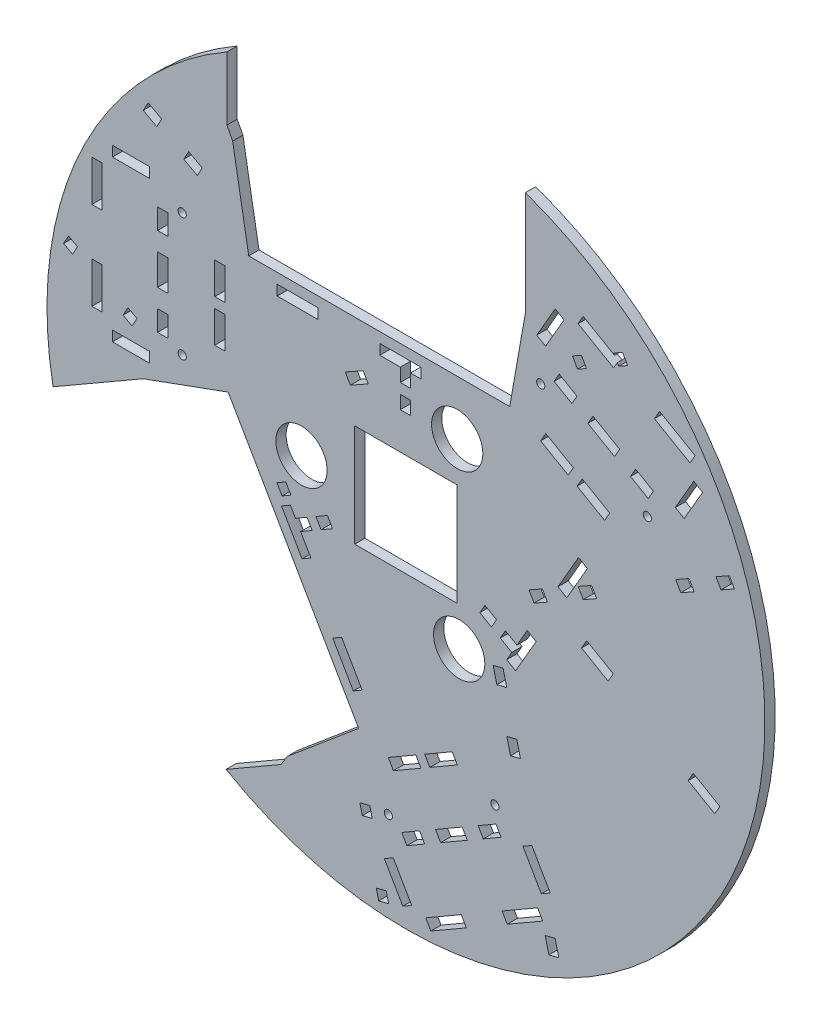
from build123d import *

# Parameters (mm, degrees)
ESQUISSE1_R                   = 175
BOSS_EXTRU_1_DEPTH            = 5
ESQUISSE2_W                   = 18
ESQUISSE2_H                   = 5
ESQUISSE2_W_2                 = 5
ESQUISSE2_H_2                 = 20
ESQUISSE2_H_3                 = 10
ESQUISSE2_H_4                 = 15
ESQUISSE2_H_5                 = 15.5
ESQUISSE2_W_3                 = 20
ESQUISSE2_H_6                 = 6.5
ENL_V_MAT_EXTRU_1_DEPTH       = 5
ESQUISSE6_R                   = 12.5
ESQUISSE6_W                   = 50
ESQUISSE6_H                   = 50
ENL_V_MAT_EXTRU_6_DEPTH       = 5
TROUS_DE_CENTRAGE_4_0MM1_D    = 4
HOLES_CATCHERS_OF_GLASS_DEPTH = 10
HOLES_BOARDS_SERVO_DEPTH      = 10


with BuildPart() as part:
    # Esquisse1 → Boss.-Extru.1 (new body)
    with BuildSketch(Plane.XY):
        with Locations((148.080426897, -12.110171348)):
            Circle(ESQUISSE1_R)
    extrude(amount=BOSS_EXTRU_1_DEPTH)

    # Esquisse2 → Enlèv. mat.-Extru.1 (cut)
    with BuildSketch(Plane.XY.offset(5)):
        Polygon((135.311788567, 53.777441362), (135.311788567, 48.777441362), (145.311788567, 48.777441362), (145.311788567, 42.277441362), (150.311788567, 42.277441362), (150.311788567, 48.777441362), (155.311788567, 48.777441362), (155.311788567, 53.777441362), align=None)
        with Locations((14, 69.777441362)):
            Rectangle(ESQUISSE2_W, ESQUISSE2_H)
        with Locations((-2.5, 52.277441362)):
            Rectangle(ESQUISSE2_W_2, ESQUISSE2_H_2)
        with Locations((-2.5, 9.277441362)):
            Rectangle(ESQUISSE2_W_2, ESQUISSE2_H_2)
        with Locations((14, -8.222558638)):
            Rectangle(ESQUISSE2_W, ESQUISSE2_H)
        with Locations((29.5, 9.277441362)):
            Rectangle(ESQUISSE2_W_2, ESQUISSE2_H_3)
        with Locations((29.5, 30.777441362)):
            Rectangle(ESQUISSE2_W_2, ESQUISSE2_H_4)
        with Locations((29.5, 52.277441362)):
            Rectangle(ESQUISSE2_W_2, ESQUISSE2_H_3)
        with Locations((57.36, 41.027441362)):
            Rectangle(ESQUISSE2_W_2, ESQUISSE2_H_5)
        with Locations((57.36, 20.527441362)):
            Rectangle(ESQUISSE2_W_2, ESQUISSE2_H_5)
        with Locations((95.311788567, 51.277441362)):
            Rectangle(ESQUISSE2_W_3, ESQUISSE2_H)
        with Locations((147.811788567, 34.027441362)):
            Rectangle(ESQUISSE2_W_2, ESQUISSE2_H_6)
        Polygon((292.702456717, 69.607306773), (283.702456717, 54.018849505), (279.372329698, 56.518849505), (288.372329698, 72.107306773), align=None)
        Polygon((289.042202679, 83.267560811), (286.542202679, 78.937433792), (269.221694603, 88.937433792), (271.721694603, 93.267560811), align=None)
        Polygon((251.803110316, 104.767560811), (249.303110316, 100.437433792), (231.982602241, 110.437433792), (234.482602241, 114.767560811), align=None)
        Polygon((225.152475222, 108.607306773), (216.152475222, 93.018849505), (211.822348203, 95.518849505), (220.822348203, 111.107306773), align=None)
        Polygon((231.472983297, 79.55474789), (228.972983297, 75.224620871), (220.31272926, 80.224620871), (222.81272926, 84.55474789), align=None)
        Polygon((252.257592988, 67.55474789), (249.757592988, 63.224620871), (236.767211932, 70.724620871), (239.267211932, 75.05474789), align=None)
        Polygon((268.71207566, 58.05474789), (266.21207566, 53.724620871), (257.551821622, 58.724620871), (260.051821622, 63.05474789), align=None)
        Polygon((247.420859728, 38.17728014), (244.920859728, 33.847153121), (231.497465969, 41.597153121), (233.997465969, 45.92728014), align=None)
        Polygon((229.66733895, 48.42728014), (227.16733895, 44.097153121), (213.743945192, 51.847153121), (216.243945192, 56.17728014), align=None)
        Polygon((211.525092463, -33.996012539), (207.194965444, -31.496012539), (202.194965444, -40.156266577), (196.56580032, -36.906266577), (194.06580032, -41.236393596), (199.694965444, -44.486393596), (197.194965444, -48.816520615), (201.525092463, -51.316520615), align=None)
        Polygon((236.525092463, 9.30525765), (226.525092463, -8.015250425), (222.194965444, -5.515250425), (232.194965444, 11.80525765), align=None)
        Polygon((192.235673301, -34.406266577), (189.735673301, -38.736393596), (184.106508176, -35.486393596), (186.606508176, -31.156266577), align=None)
        Polygon((146.538823973, -178.215262181), (137.538823973, -162.626804912), (141.868950992, -160.126804912), (150.868950992, -175.715262181), align=None)
        Polygon((160.199078011, -181.875516218), (157.699078011, -177.545389199), (175.019586086, -167.545389199), (177.519586086, -171.875516218), align=None)
        Polygon((197.438170373, -160.375516218), (194.938170373, -156.045389199), (212.258678449, -146.045389199), (214.758678449, -150.375516218), align=None)
        Polygon((214.088805468, -139.215262181), (205.088805468, -123.626804912), (209.418932487, -121.126804912), (218.418932487, -136.715262181), align=None)
        Polygon((185.768297392, -130.162703297), (183.268297392, -125.832576278), (191.92855143, -120.832576278), (194.42855143, -125.162703297), align=None)
        Polygon((164.983687701, -142.162703297), (162.483687701, -137.832576278), (175.474068758, -130.332576278), (177.974068758, -134.662703297), align=None)
        Polygon((148.52920503, -151.662703297), (146.02920503, -147.332576278), (154.689459067, -142.332576278), (157.189459067, -146.662703297), align=None)
        Polygon((141.960420962, -123.285235548), (139.460420962, -118.955108529), (152.88381472, -111.205108529), (155.38381472, -115.535235548), align=None)
        Polygon((159.713941739, -113.035235548), (157.213941739, -108.705108529), (170.637335498, -100.955108529), (173.137335498, -105.285235548), align=None)
        Polygon((97.404399659, -56.111942869), (101.734526678, -53.611942869), (96.734526678, -44.951688831), (102.363691803, -41.701688831), (99.863691803, -37.371561812), (94.234526678, -40.621561812), (91.734526678, -36.291434793), (87.404399659, -38.791434793), align=None)
        Polygon((122.404399659, -99.413213058), (112.404399659, -82.092704982), (116.734526678, -79.592704982), (126.734526678, -96.913213058), align=None)
        Polygon((106.693818822, -39.201688831), (104.193818822, -34.871561812), (109.822983946, -31.621561812), (112.322983946, -35.951688831), align=None)
    extrude(amount=-ENL_V_MAT_EXTRU_1_DEPTH, mode=Mode.SUBTRACT)

    # Esquisse6 → Enlèv. mat.-Extru.6 (cut)
    with BuildSketch(Plane.XY.offset(5)):
        with Locations((173.06, 32.277441362)):
            Circle(ESQUISSE6_R)
        with Locations((174.031440566, -55.936922587)):
            Circle(ESQUISSE6_R)
        with Locations((97.149840124, -12.671032821)):
            Circle(ESQUISSE6_R)
        Polygon((206.321253746, 102.221853729), (206.321253746, 185.563712918), (60.797190046, 185.563712918), (60.797190046, 108.682370842), (63.584787187, 103.348250546), (71.443823398, 58.777441362), (198.660831685, 58.777441362), align=None)
        with Locations((148.080426897, -12.110171348)):
            Rectangle(ESQUISSE6_W, ESQUISSE6_H)
        Polygon((19.945575289, -18.838148298), (-52.230591968, -60.509077893), (20.531439882, -186.536613919), (87.112635197, -148.095942881), (90.338320311, -143.014752793), (125.008255225, -113.923223194), (61.399751081, -3.750062223), align=None)
        Polygon((236.171367804, -21.307411432), (249.16174886, -28.807411432), (246.66174886, -33.137538451), (233.671367804, -25.637538451), align=None)
        Polygon((288.132892031, -51.307411432), (301.123273088, -58.807411432), (298.623273088, -63.137538451), (285.632892031, -55.637538451), align=None)
    extrude(amount=-ENL_V_MAT_EXTRU_6_DEPTH, mode=Mode.SUBTRACT)

    # Trous de centrage Ø4.0mm1 (through all)
    with Locations(Plane(origin=(148.080426897, -12.110171348, -78), x_dir=(1, 0, 0), z_dir=(0, 0, -1))):
        with Locations((65.70121345, -88.022614393), (117.662737677, -58.022614393), (-109.080426897, -72.887612711), (-109.080426897, -12.887612711), (-8.58231078, 130.910227103), (43.379213447, 100.910227103)):
            Hole(TROUS_DE_CENTRAGE_4_0MM1_D / 2)

    # Esquisse9 → Holes catchers of glass (cut)
    with BuildSketch(Plane.XY.offset(5)):
        Polygon((301.647255965, 32.874727734), (299.200467122, 37.235143352), (305.741090548, 40.905326617), (308.187879391, 36.544910999), align=None)
        Polygon((282.025385687, 21.864177939), (279.578596844, 26.224593557), (286.11922027, 29.894776822), (288.566009113, 25.534361204), align=None)
        Polygon((241.037478884, -1.135637188), (238.590690041, 3.22477843), (232.050066614, -0.445404835), (234.496855458, -4.805820453), align=None)
        Polygon((214.608404145, -10.232560209), (217.055192988, -14.592975826), (210.514569562, -18.263159091), (208.067780719, -13.902743474), align=None)
        Polygon((256.127471573, 104.799683271), (251.767055956, 102.352894427), (249.320267112, 106.713310045), (253.68068273, 109.160098888), align=None)
        Polygon((236.069559733, 93.544454591), (231.709144116, 91.097665748), (229.262355272, 95.458081365), (233.62277089, 97.904870209), align=None)
        Polygon((129.675418669, 33.842806815), (120.954587434, 28.949229128), (118.507798591, 33.309644745), (127.228629826, 38.203222432), align=None)
        Polygon((-16.43844555, 23.279140051), (-12.045948181, 20.890423478), (-14.434664754, 16.49792611), (-18.827162123, 18.886642683), align=None)
        Polygon((12.552037084, 7.51361067), (16.944534453, 5.124894098), (14.55581788, 0.732396729), (10.163320511, 3.121113302), align=None)
        Polygon((22.412737241, 98.907081949), (29.001483294, 95.32400709), (26.612766722, 90.931509721), (20.024020668, 94.514584581), align=None)
        Polygon((42.178975401, 88.157857372), (48.767721454, 84.574782512), (46.379004881, 80.182285143), (39.790258828, 83.765360003), align=None)
        Polygon((126.799616111, -149.834276272), (125.585690653, -144.983875775), (130.43609115, -143.769950316), (131.650016608, -148.620350813), align=None)
        Polygon((134.811524138, -181.846919552), (133.597598679, -176.996519055), (138.447999176, -175.782593596), (139.661924635, -180.632994093), align=None)
        Polygon((190.561972498, -54.501375823), (195.412372995, -53.287450364), (197.233261183, -60.56305111), (192.382860686, -61.776976568), align=None)
        Polygon((202.088963017, -79.964653097), (197.23856252, -81.178578556), (199.059450708, -88.454179302), (203.909851205, -87.240253843), align=None)
        Polygon((222.604303267, -161.936421496), (217.75390277, -163.150346955), (215.933014582, -155.874746209), (220.783415079, -154.660820751), align=None)
    extrude(amount=-HOLES_CATCHERS_OF_GLASS_DEPTH, mode=Mode.SUBTRACT)

    # Esquisse10 → Holes boards servo (cut)
    with BuildSketch(Plane.XY.offset(5)):
        Polygon((89.496120404, -27.614401399), (91.996120404, -31.944528418), (87.66720686, -34.443827818), (85.16720686, -30.113700799), align=None)
    extrude(amount=-HOLES_BOARDS_SERVO_DEPTH, mode=Mode.SUBTRACT)


solid = part.part
